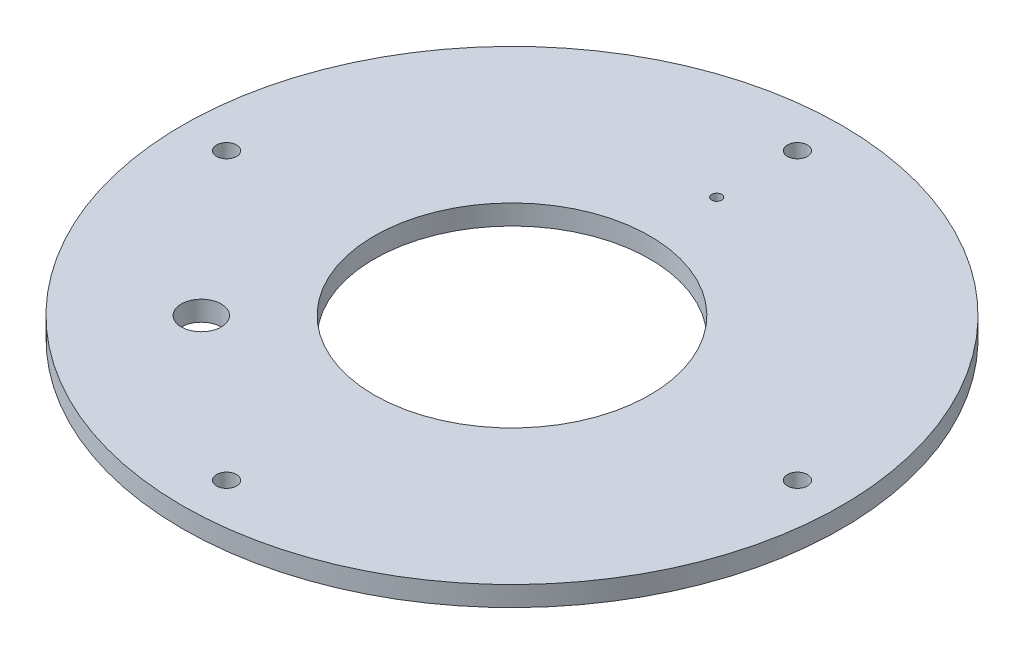
from build123d import *

# Parameters (mm, degrees)
SKETCH1_R                                       = 16.5
SKETCH1_R_2                                     = 6.9
BOSS_EXTRUDE1_DEPTH                             = 1
CSK_FOR_M2_FLAT_HEAD_MACHINE_SCREW1_D           = 1
CSK_FOR_M2_FLAT_HEAD_MACHINE_SCREW1_CSINK_D     = 1.6
CSK_FOR_M2_FLAT_HEAD_MACHINE_SCREW1_CSINK_ANGLE = 100
CUT_EXTRUDE1_DEPTH                              = 24.355941428
CUT_EXTRUDE1_DEPTH_BACK                         = 24.355941428
SKETCH4_R                                       = 0.25
SKETCH4_R_2                                     = 1


with BuildPart() as part:
    # Sketch1 → Boss-Extrude1 (new body)
    with BuildSketch(Plane(origin=(0, 0, 0), x_dir=(1, 0, 0), z_dir=(0, 1, 0))):
        Circle(SKETCH1_R)
        Circle(SKETCH1_R_2, mode=Mode.SUBTRACT)
    extrude(amount=BOSS_EXTRUDE1_DEPTH)

    # CSK for M2 Flat Head Machine Screw1 (through all)
    with Locations(Plane(origin=(0, 0, 0), x_dir=(-1, 0, 0), z_dir=(0, -1, 0))):
        with Locations((0, -14.29), (-14.29, 0), (0, 14.29), (14.29, 0)):
            CounterSinkHole(CSK_FOR_M2_FLAT_HEAD_MACHINE_SCREW1_D / 2, CSK_FOR_M2_FLAT_HEAD_MACHINE_SCREW1_CSINK_D / 2, counter_sink_angle=CSK_FOR_M2_FLAT_HEAD_MACHINE_SCREW1_CSINK_ANGLE)

    # Sketch4 → Cut-Extrude1 (cut, two sides: drawn at the far end of the back side and taken through both)
    with BuildSketch(Plane(origin=(0, 1, 0), x_dir=(1, 0, 0), z_dir=(0, 1, 0)).offset(-CUT_EXTRUDE1_DEPTH_BACK)):
        with Locations((0, 10.25)):
            Circle(SKETCH4_R)
        with Locations((-7.778174593, -7.778174593)):
            Circle(SKETCH4_R_2)
    extrude(amount=CUT_EXTRUDE1_DEPTH + CUT_EXTRUDE1_DEPTH_BACK, mode=Mode.SUBTRACT)


solid = part.part
